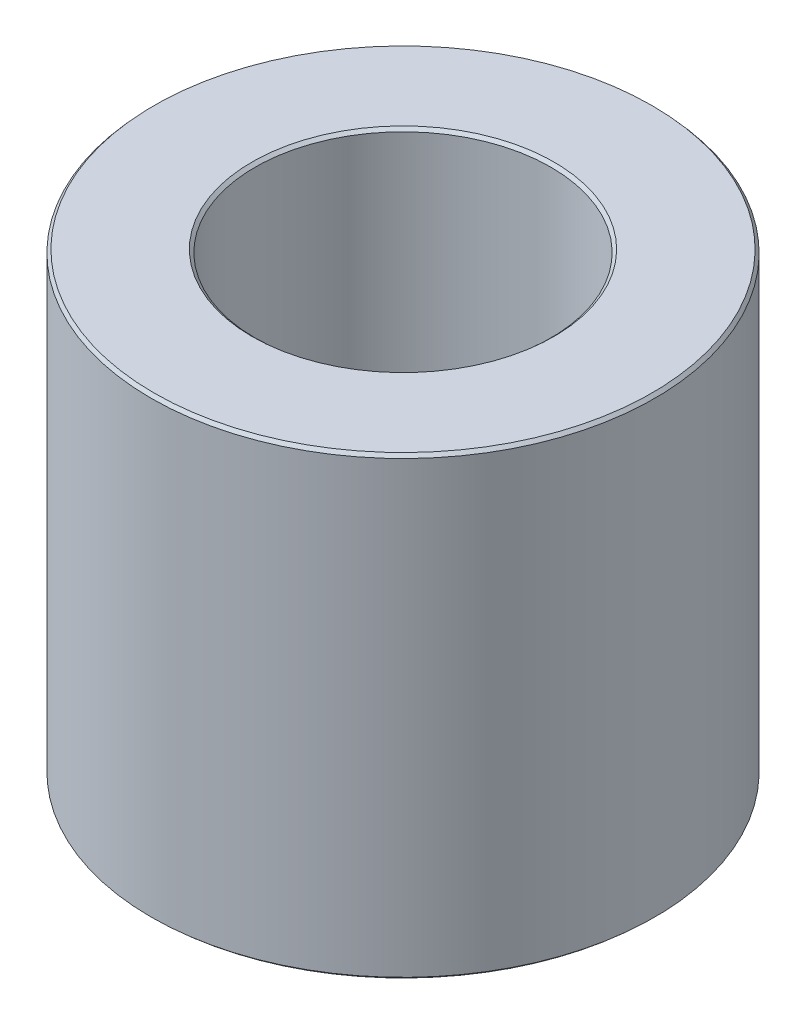
from build123d import *
from OCP.BRepFilletAPI import BRepFilletAPI_MakeChamfer

# Parameters (mm, degrees)
SKETCH1_R           = 17.5
BOSS_EXTRUDE1_DEPTH = 31.642927666
SKETCH2_R           = 10.278507718
CUT_EXTRUDE1_DEPTH  = 41.171816878
CHAMFER1_SIZE       = 0.221493997
CHAMFER1_SIZE2      = 0.197430008


with BuildPart() as part:
    # Sketch1 → Boss-Extrude1 (new body)
    with BuildSketch(Plane(origin=(0, 0, 0), x_dir=(1, 0, 0), z_dir=(0, 1, 0))):
        Circle(SKETCH1_R)
    extrude(amount=BOSS_EXTRUDE1_DEPTH)

    # Sketch2 → Cut-Extrude1 (cut, through all)
    with BuildSketch(Plane(origin=(0, 0, 0), x_dir=(1, 0, 0), z_dir=(0, 1, 0))):
        Circle(SKETCH2_R)
    extrude(amount=CUT_EXTRUDE1_DEPTH, mode=Mode.SUBTRACT)

    # Chamfer1: one chamfer whose edges measure the first distance from different faces: ONE call of the kernel's chamfer builder (chamfer() names one face for all edges)
    chamfer1_edges_1 = [part.edges().sort_by_distance(p)[0] for p in [
        (-10.278507718, 31.642927666, 0),
    ]]
    chamfer1_side_1 = [part.faces().sort_by_distance(p)[0] for p in [
        (-17.005025253, 31.642927666, 0),
    ]]
    chamfer1_edges_2 = [part.edges().sort_by_distance(p)[0] for p in [
        (-10.278507718, 0, 0),
    ]]
    chamfer1_side_2 = [part.faces().sort_by_distance(p)[0] for p in [
        (-10.278507718, 15.821463833, 0),
    ]]
    chamfer1_edges_3 = [part.edges().sort_by_distance(p)[0] for p in [
        (-17.5, 0, 0),
    ]]
    chamfer1_side_3 = [part.faces().sort_by_distance(p)[0] for p in [
        (-17.005025253, 0, 0),
    ]]
    chamfer1_edges_4 = [part.edges().sort_by_distance(p)[0] for p in [
        (-17.5, 31.642927666, 0),
    ]]
    chamfer1_side_4 = [part.faces().sort_by_distance(p)[0] for p in [
        (-17.5, 15.821463833, 0),
    ]]
    chamfer1 = BRepFilletAPI_MakeChamfer(part.part.solid().wrapped)
    for e in chamfer1_edges_1:
        chamfer1.Add(CHAMFER1_SIZE, CHAMFER1_SIZE2, e.wrapped, chamfer1_side_1[0].wrapped)  # the first distance lies on this face
    for e in chamfer1_edges_2:
        chamfer1.Add(CHAMFER1_SIZE, CHAMFER1_SIZE2, e.wrapped, chamfer1_side_2[0].wrapped)  # the first distance lies on this face
    for e in chamfer1_edges_3:
        chamfer1.Add(CHAMFER1_SIZE, CHAMFER1_SIZE2, e.wrapped, chamfer1_side_3[0].wrapped)  # the first distance lies on this face
    for e in chamfer1_edges_4:
        chamfer1.Add(CHAMFER1_SIZE, CHAMFER1_SIZE2, e.wrapped, chamfer1_side_4[0].wrapped)  # the first distance lies on this face
    add(Compound.cast(chamfer1.Shape()), mode=Mode.REPLACE)


solid = part.part
